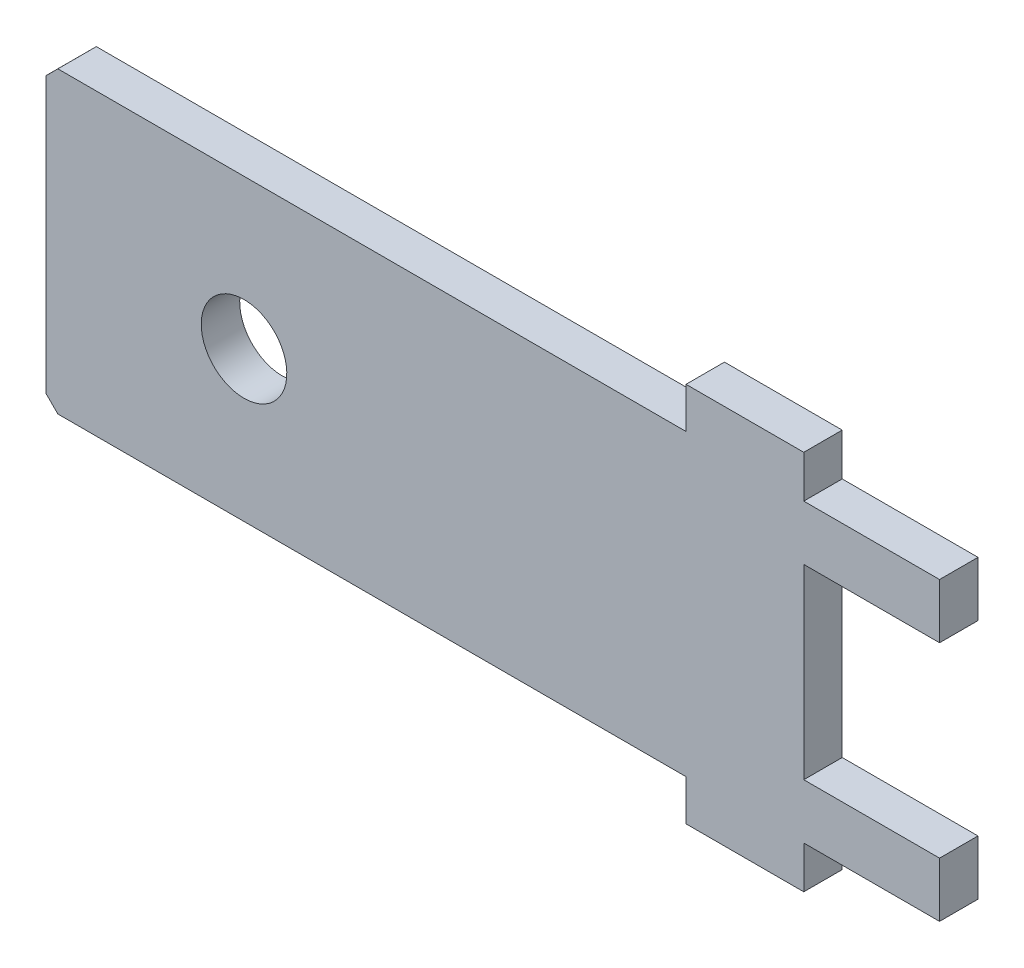
from build123d import *

# Parameters (mm, degrees)
EXTRUSION1_DEPTH        = 0.8
ESQUISSE2_R             = 0.89
ENL_V_MAT_EXTRU_1_DEPTH = 0.8
CHANFREIN1_SIZE         = 0.4
CHANFREIN2_SIZE         = 0.4


with BuildPart() as part:
    # Esquisse1 → Extrusion1 (new body)
    with BuildSketch(Plane(origin=(0, 0, 0), x_dir=(0, 1, 0), z_dir=(0, 0, 1))):
        Polygon((-3.96, 0.034), (-3.08, 0.034), (-3.08, -2.791082591), (-1.94, -2.791082591), (-1.94, 0.034), (1.94, 0.034), (1.94, -2.791082591), (3.08, -2.791082591), (3.08, 0.034), (3.96, 0.034), (3.96, 2.484), (3.11, 2.484), (3.11, 15.553159959), (2.464351087, 16.2), (-2.464351087, 16.2), (-3.11, 15.553159959), (-3.11, 2.484), (-3.96, 2.484), align=None)
    extrude(amount=EXTRUSION1_DEPTH)

    # Esquisse2 → Enlèv. mat.-Extru.1 (cut)
    with BuildSketch(Plane(origin=(0, 0, 0.8), x_dir=(0, 1, 0), z_dir=(0, 0, 1))):
        with Locations(Location((0, 11.68, 0), (0, 0, 180))):
            Circle(ESQUISSE2_R)
    extrude(amount=-ENL_V_MAT_EXTRU_1_DEPTH, mode=Mode.SUBTRACT)

    # Chanfrein1
    chanfrein1_edges = [part.edges().sort_by_distance(p)[0] for p in [
        (-16.2, 0, 0),
    ]]
    chamfer(chanfrein1_edges, length=CHANFREIN1_SIZE)

    # Chanfrein2
    chanfrein2_edges = [part.edges().sort_by_distance(p)[0] for p in [
        (-16.2, 0, 0.8),
    ]]
    chamfer(chanfrein2_edges, length=CHANFREIN2_SIZE - 0.0001)  # a hair under: the kernel refuses the full size


solid = part.part
